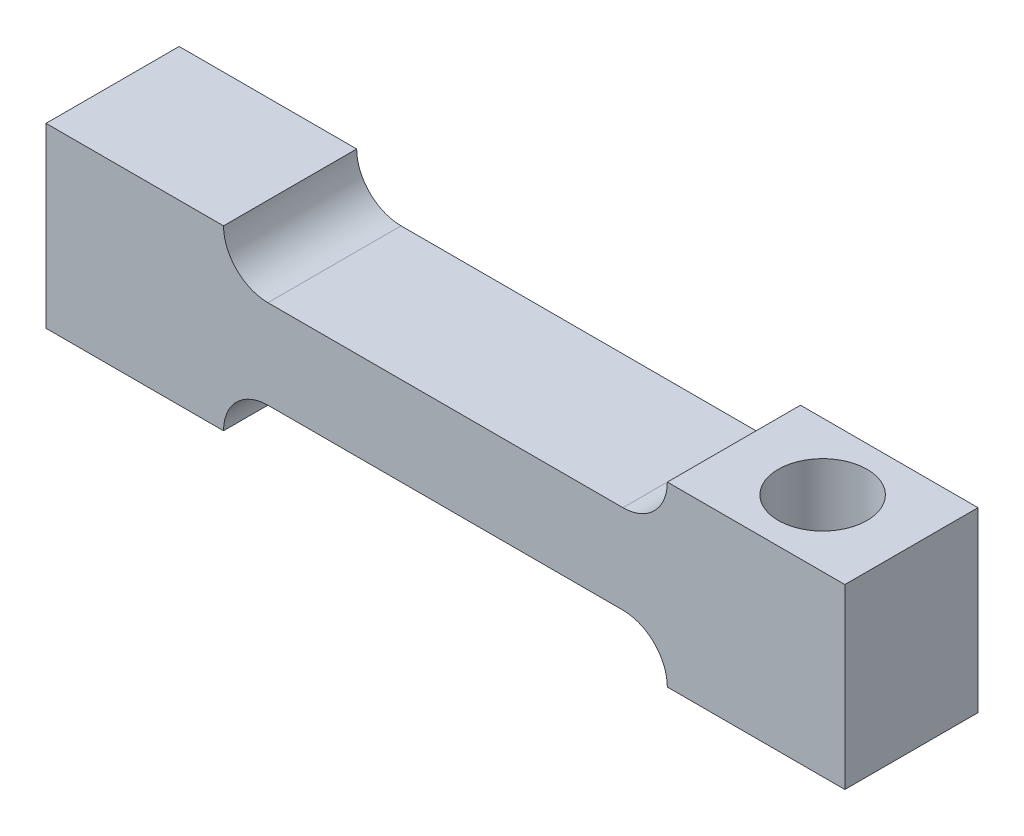
from build123d import *

# Parameters (mm, degrees)
BOSS_EXTRUDE2_DEPTH = 30
FILLET1_R           = 10
SKETCH3_R           = 10
CUT_EXTRUDE1_DEPTH  = 187.815416923


with BuildPart() as part:
    # Sketch2 → Boss-Extrude2 (new body)
    with BuildSketch(Plane.XY):
        Polygon((0, 0), (0, 10), (-40, 10), (-40, 0), (-140, 0), (-140, 10), (-180, 10), (-180, -30), (-140, -30), (-140, -20), (-40, -20), (-40, -30), (0, -30), align=None)
    extrude(amount=BOSS_EXTRUDE2_DEPTH)

    # Fillet1
    fillet1_edges = [part.edges().sort_by_distance(p)[0] for p in [
        (-40, -20, 15),
        (-140, -20, 15),
        (-40, 0, 15),
        (-140, 0, 15),
    ]]
    fillet(fillet1_edges, radius=FILLET1_R - 0.0001)  # a hair under: the kernel refuses the full size

    # Sketch3 → Cut-Extrude1 (cut, through all)
    with BuildSketch(Plane(origin=(0, 10, 0), x_dir=(1, 0, 0), z_dir=(0, 1, 0))):
        with Locations(Location((-20, -15, 0), (0, 0, 180))):
            Circle(SKETCH3_R)
        with Locations((-200, -15)):
            Circle(SKETCH3_R)
    extrude(amount=-CUT_EXTRUDE1_DEPTH, mode=Mode.SUBTRACT)


solid = part.part
